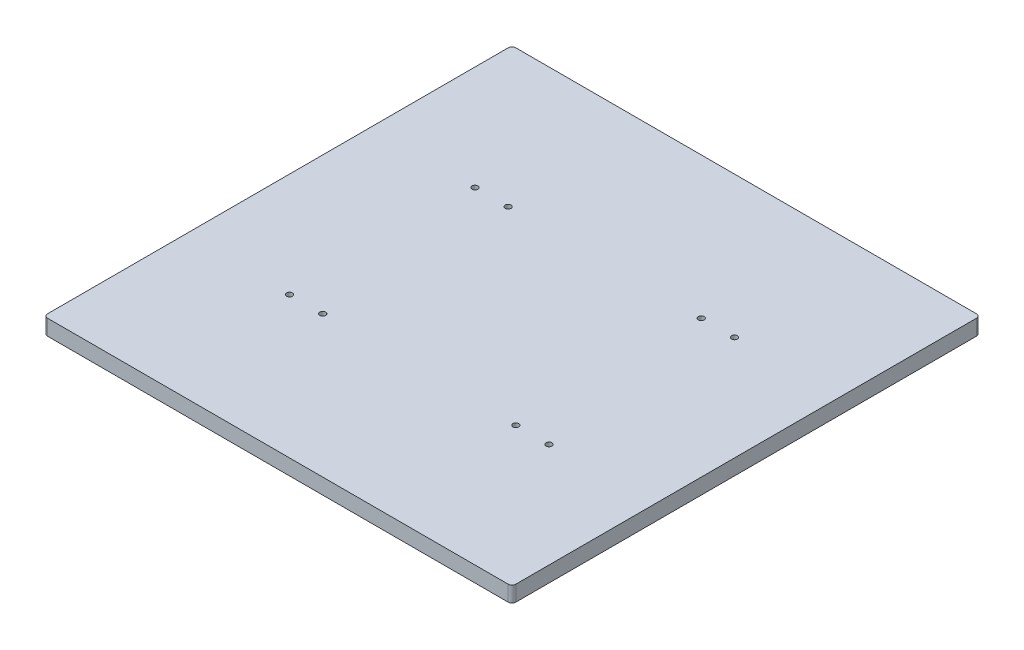
from build123d import *

# Parameters (mm, degrees)
EXTRUDE_1_DEPTH    = 8
SKETCH2_R          = 1.5
CUT_EXTRUDE1_DEPTH = 170.894084653


with BuildPart() as part:
    # 草图1 → 凸台-拉伸1 (new body)
    with BuildSketch(Plane(origin=(0, 0, 0), x_dir=(1, 0, 0), z_dir=(0, 1, 0))):
        with BuildLine():
            Line((-118, -120), (118, -120))
            ThreePointArc((118, -120), (119.414213562, -119.414213562), (120, -118))
            Line((120, -118), (120, 118))
            ThreePointArc((120, 118), (119.414213562, 119.414213562), (118, 120))
            Line((118, 120), (-118, 120))
            ThreePointArc((-118, 120), (-119.414213562, 119.414213562), (-120, 118))
            Line((-120, 118), (-120, -118))
            ThreePointArc((-120, -118), (-119.414213562, -119.414213562), (-118, -120))
        make_face()
    extrude(amount=-EXTRUDE_1_DEPTH)

    # Sketch2 → Cut-Extrude1 (cut, through all)
    with BuildSketch(Plane.XZ.offset(8)):
        with Locations((-66.5, 47.5)):
            Circle(SKETCH2_R)
        with Locations((-49.5, 47.5)):
            Circle(SKETCH2_R)
        with Locations((-66.5, -47.5)):
            Circle(SKETCH2_R)
        with Locations((-49.5, -47.5)):
            Circle(SKETCH2_R)
        with Locations((49.5, -47.5)):
            Circle(SKETCH2_R)
        with Locations((66.5, -47.5)):
            Circle(SKETCH2_R)
        with Locations((49.5, 47.5)):
            Circle(SKETCH2_R)
        with Locations((66.5, 47.5)):
            Circle(SKETCH2_R)
    extrude(amount=-CUT_EXTRUDE1_DEPTH, mode=Mode.SUBTRACT)


solid = part.part
